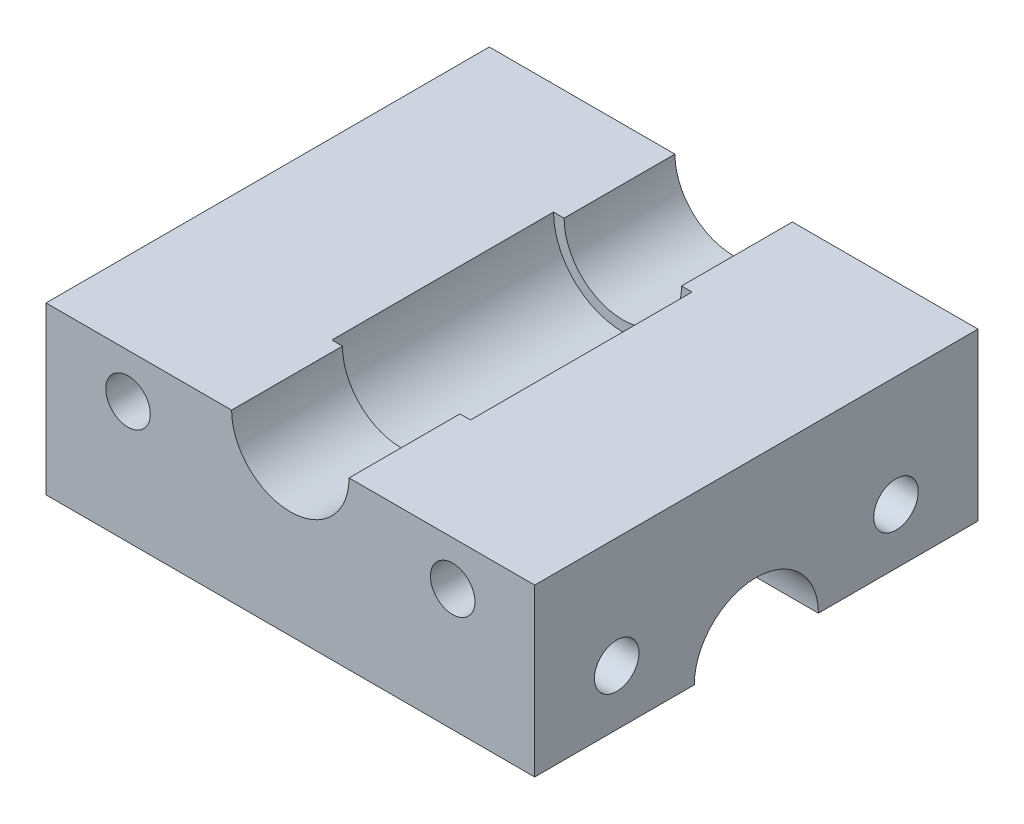
from build123d import *

# Parameters (mm, degrees)
BOSS_EXTRUDE1_DEPTH              = 50.8
SKETCH2_R                        = 7.9375
CUT_EXTRUDE1_DEPTH               = 12.7
F_10_CLEARANCE_HOLE1_D           = 5.1054
F_10_CLEARANCE_HOLE1_ON_FACE_2_D = 5.1054
CUT_EXTRUDE4_DEPTH               = 78.403585391


with BuildPart() as part:
    # Sketch1 → Boss-Extrude1 (new body)
    with BuildSketch(Plane.XY):
        with BuildLine():
            Line((23.736970149, 16.573322883), (45.005970149, 16.573322883))
            Line((45.005970149, 16.573322883), (45.005970149, -2.476677117))
            Line((45.005970149, -2.476677117), (-10.994029851, -2.476677117))
            Line((-10.994029851, -2.476677117), (-10.994029851, 16.573322883))
            Line((-10.994029851, 16.573322883), (10.274970149, 16.573322883))
            ThreePointArc((10.274970149, 16.573322883), (17.005970149, 9.842322883), (23.736970149, 16.573322883))
        make_face()
    extrude(amount=BOSS_EXTRUDE1_DEPTH)

    # Sketch2 → Cut-Extrude1 (cut, symmetric)
    with BuildSketch(Plane.XY.offset(25.4)):
        with Locations((17.005970149, 16.573322883)):
            Circle(SKETCH2_R)
    extrude(amount=CUT_EXTRUDE1_DEPTH, both=True, mode=Mode.SUBTRACT)

    # #10 Clearance Hole1 (through all)
    with Locations(Plane(origin=(-10.994029851, 3.873322883, 41.402), x_dir=(0, 0, -1), z_dir=(-1, 0, 0))):
        with Locations((0, 0), (32.004, 0)):
            Hole(F_10_CLEARANCE_HOLE1_D / 2)

    # #10 Clearance Hole1 on face 2 (through all)
    with Locations(Plane(origin=(-1.596029851, 11.493322883, 50.8), x_dir=(1, 0, 0), z_dir=(0, 0, 1))):
        with Locations((0, 0), (37.204, 0)):
            Hole(F_10_CLEARANCE_HOLE1_ON_FACE_2_D / 2)

    # Sketch9 → Cut-Extrude4 (cut, through all)
    with BuildSketch(Plane(origin=(45.005970149, 0, 0), x_dir=(0, 0, -1), z_dir=(1, 0, 0))):
        with BuildLine():
            Line((-32.512, -2.476677117), (-18.288, -2.476677117))
            ThreePointArc((-18.288, -2.476677117), (-25.4, 4.635322883), (-32.512, -2.476677117))
        make_face()
    extrude(amount=-CUT_EXTRUDE4_DEPTH, mode=Mode.SUBTRACT)


solid = part.part
